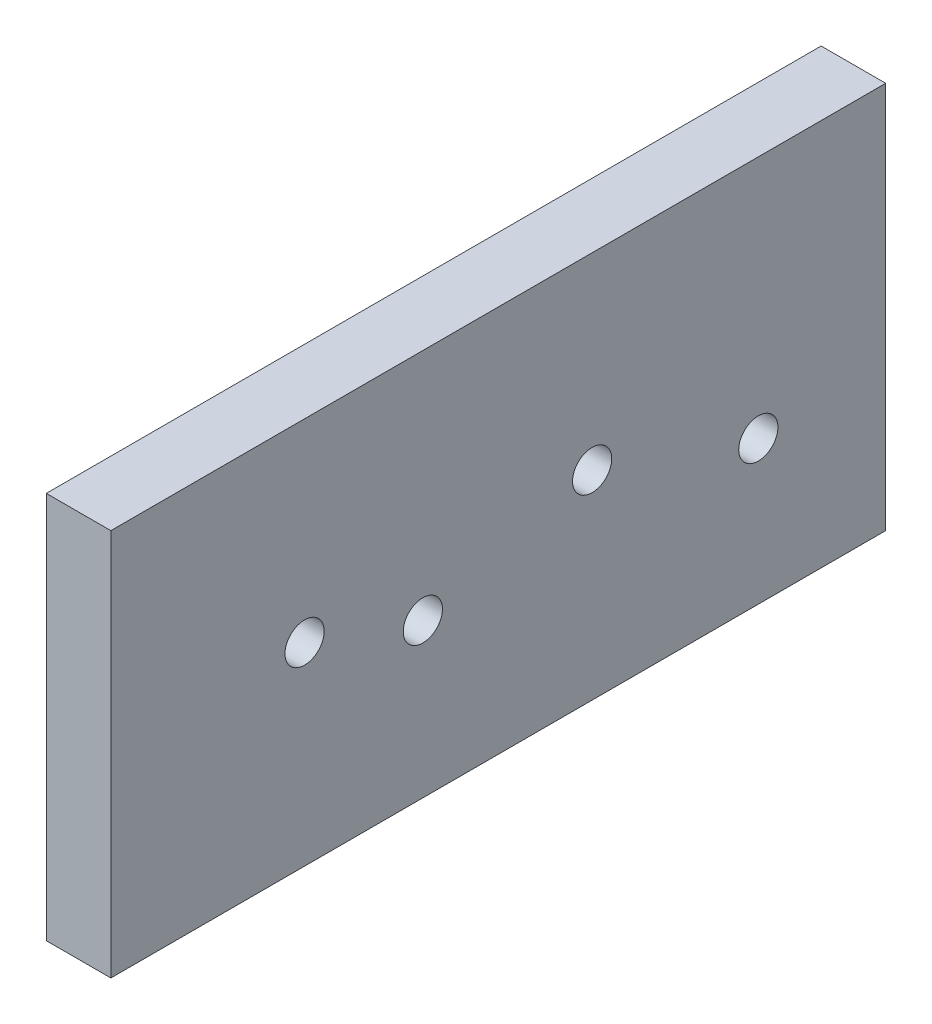
from build123d import *

# Parameters (mm, degrees)
SKETCH1_W                       = 152.4
SKETCH1_H                       = 76.2
SKETCH1_R                       = 3.854557775
BOSS_EXTRUDE1_DEPTH             = 12.7
F_1_4_0_25_DIAMETER_HOLE2_D     = 6.35
F_1_4_0_25_DIAMETER_HOLE2_DEPTH = 38.1
F_1_4_0_25_DIAMETER_HOLE2_TIP   = 1.907732465
SKETCH2_R                       = 6.223
CUT_EXTRUDE1_DEPTH              = 4.7625


with BuildPart() as part:
    # Sketch1 → Boss-Extrude1 (new body)
    with BuildSketch(Plane(origin=(0, 0, 0), x_dir=(0, 0, -1), z_dir=(1, 0, 0))):
        Rectangle(SKETCH1_W, SKETCH1_H)
        with Locations((18.457733582, 1.096077429)):
            Circle(SKETCH1_R, mode=Mode.SUBTRACT)
        with Locations((-38.1, 0)):
            Circle(SKETCH1_R, mode=Mode.SUBTRACT)
        with Locations((-14.836022013, -7.860160654)):
            Circle(SKETCH1_R, mode=Mode.SUBTRACT)
        with Locations((51.143457994, -9.873506971)):
            Circle(SKETCH1_R, mode=Mode.SUBTRACT)
    extrude(amount=BOSS_EXTRUDE1_DEPTH)

    # 1/4 (0.25) Diameter Hole2
    with Locations(Plane.XZ.offset(38.1)):
        with Locations((6.35, 57.15), (6.35, -63.5), (6.35, 0)):
            Hole(F_1_4_0_25_DIAMETER_HOLE2_D / 2, depth=F_1_4_0_25_DIAMETER_HOLE2_DEPTH)
            with Locations((0, 0, -(F_1_4_0_25_DIAMETER_HOLE2_DEPTH + F_1_4_0_25_DIAMETER_HOLE2_TIP / 2))):  # 118° drill point
                Cone(0, F_1_4_0_25_DIAMETER_HOLE2_D / 2, F_1_4_0_25_DIAMETER_HOLE2_TIP, mode=Mode.SUBTRACT)

    # Sketch2 → Cut-Extrude1 (cut)
    with BuildSketch(Plane.ZY):
        with Locations((38.1, 0)):
            Circle(SKETCH2_R)
        with Locations((14.836022013, -7.860160654)):
            Circle(SKETCH2_R)
        with Locations((-18.457733582, 1.096077429)):
            Circle(SKETCH2_R)
        with Locations((-51.143457994, -9.873506971)):
            Circle(SKETCH2_R)
    extrude(amount=-CUT_EXTRUDE1_DEPTH, mode=Mode.SUBTRACT)


solid = part.part
